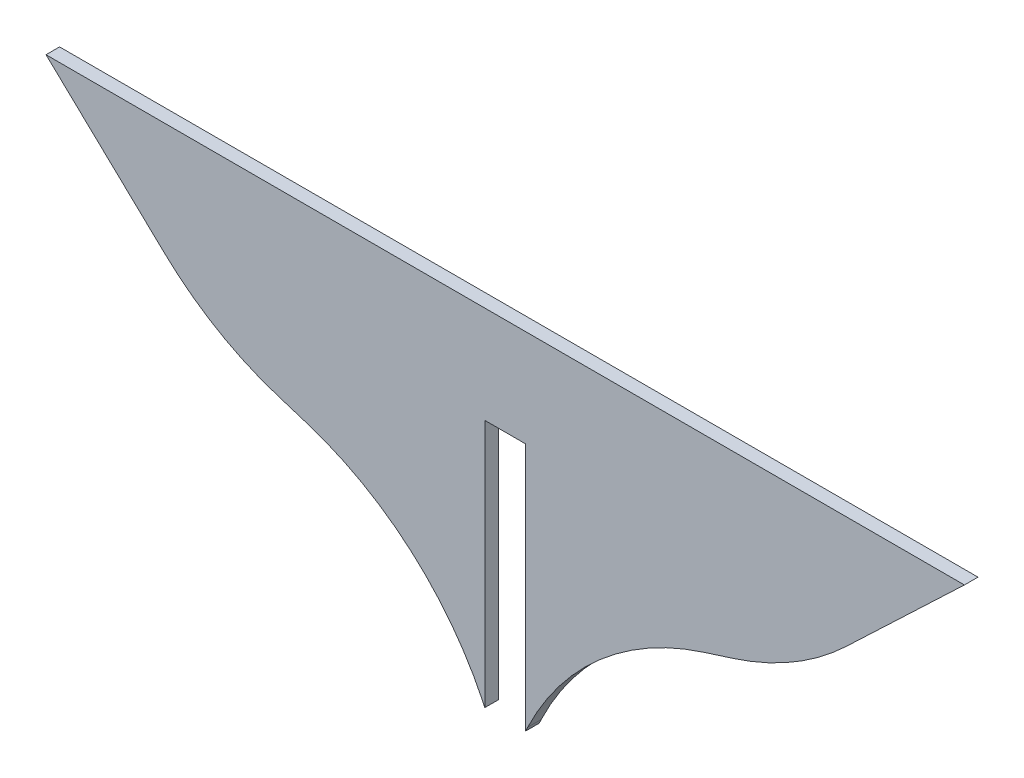
from build123d import *

# Parameters (mm, degrees)
BOSS_EXTRU_1_DEPTH = 3
CONG_1_R           = 65


with BuildPart() as part:
    # Esquisse1 → Boss.-Extru.1 (new body)
    with BuildSketch(Plane.XY):
        Polygon((11.917194627, -63.875697686), (11.917194627, -8.875697686), (2.917194627, -8.875697686), (2.917194627, -63.875697686), (-9.685408362, -37.63772276), (-57.17760897, -22.472146095), (-94.113372898, 12.624302314), (108.947762152, 12.624302314), (72.011998224, -22.472146095), (24.519797616, -37.63772276), align=None)
    extrude(amount=BOSS_EXTRU_1_DEPTH)

    # Congé1
    cong_1_edges = [part.edges().sort_by_distance(p)[0] for p in [
        (72.011998224, -22.472146095, 1.5),
        (24.519797616, -37.63772276, 1.5),
        (-57.17760897, -22.472146095, 1.5),
        (-9.685408362, -37.63772276, 1.5),
    ]]
    fillet(cong_1_edges, radius=CONG_1_R)


solid = part.part
